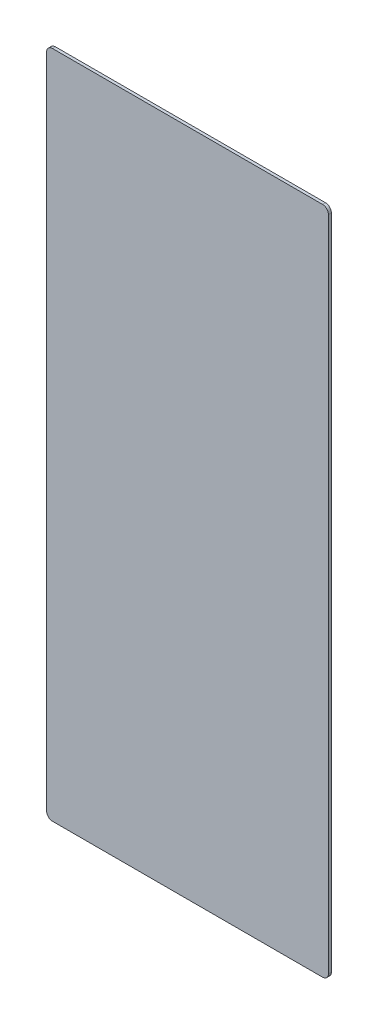
from build123d import *

# Parameters (mm, degrees)
FRONT_STOCK_DEPTH = 3.175


with BuildPart() as part:
    # Sketch3 → Front Stock (new body)
    with BuildSketch(Plane.XY):
        with BuildLine():
            Line((-146.05, -361.95), (146.05, -361.95))
            ThreePointArc((146.05, -361.95), (150.540128061, -360.090128061), (152.4, -355.6))
            Line((152.4, -355.6), (152.4, 355.6))
            ThreePointArc((152.4, 355.6), (150.540128061, 360.090128061), (146.05, 361.95))
            Line((146.05, 361.95), (-146.05, 361.95))
            ThreePointArc((-146.05, 361.95), (-150.540128061, 360.090128061), (-152.4, 355.6))
            Line((-152.4, 355.6), (-152.4, -355.6))
            ThreePointArc((-152.4, -355.6), (-150.540128061, -360.090128061), (-146.05, -361.95))
        make_face()
    extrude(amount=FRONT_STOCK_DEPTH)


solid = part.part
